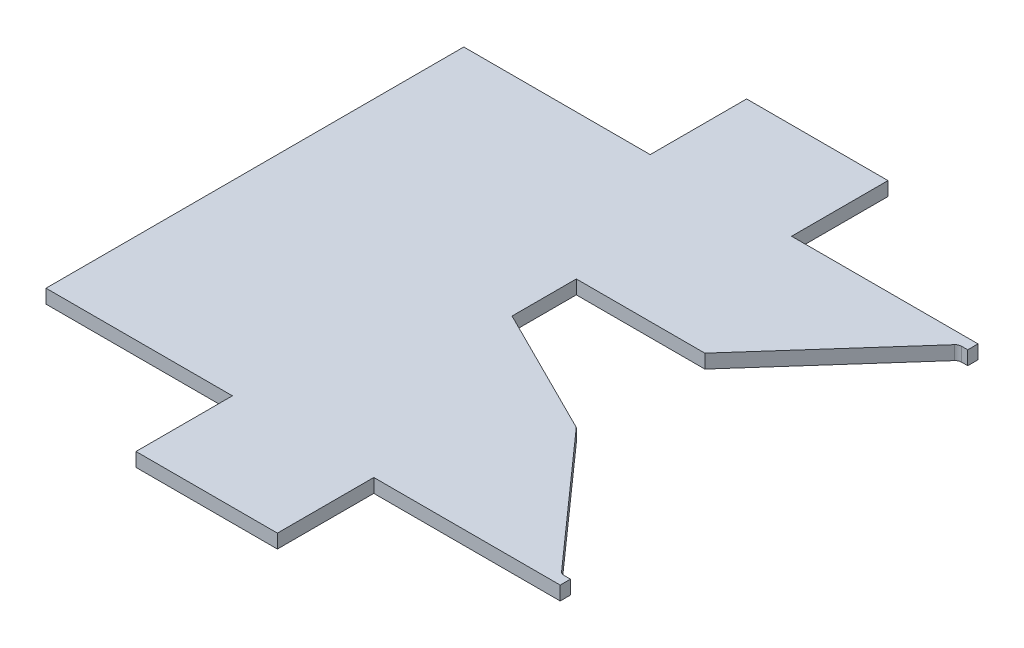
from build123d import *

# Parameters (mm, degrees)
BOSS_EXTRUDE1_DEPTH = 4.3
CUT_EXTRUDE1_DEPTH  = 4.5
FILLET1_R           = 2


with BuildPart() as part:
    # Sketch2 → Boss-Extrude1 (new body)
    with BuildSketch(Plane(origin=(0, 0, 0), x_dir=(1, 0, 0), z_dir=(0, 1, 0))):
        Polygon((0, 0), (0, 65), (58, 65), (58, 95), (102, 95), (102, 65), (160, 65), (160, 0), align=None)
    extrude(amount=BOSS_EXTRUDE1_DEPTH)

    # Mirror1: part across plane


with BuildPart() as part_1:
    add(part.part)
    add(part.part.mirror(Plane(origin=(0, 4.3, 0), x_dir=(1, 0, 0), z_dir=(0, 0, -1))))

    # Sketch3 → Cut-Extrude1 (cut)
    with BuildSketch(Plane(origin=(0, 4.3, 0), x_dir=(1, 0, 0), z_dir=(0, 1, 0))):
        Polygon((160, -61.8), (160, 61.8), (157.156451185, 61.8), (120.012594795, 20), (80.012594795, 20), (80.012594795, 0), (120, -20), (157.155555556, -61.8), align=None)
    extrude(amount=-CUT_EXTRUDE1_DEPTH, mode=Mode.SUBTRACT)

    # Fillet1
    fillet1_edges = [part_1.edges().sort_by_distance(p)[0] for p in [
        (157.156451185, 2.15, -61.8),
        (157.155555556, 2.15, 61.8),
    ]]
    fillet(fillet1_edges, radius=FILLET1_R)


solid = part_1.part
